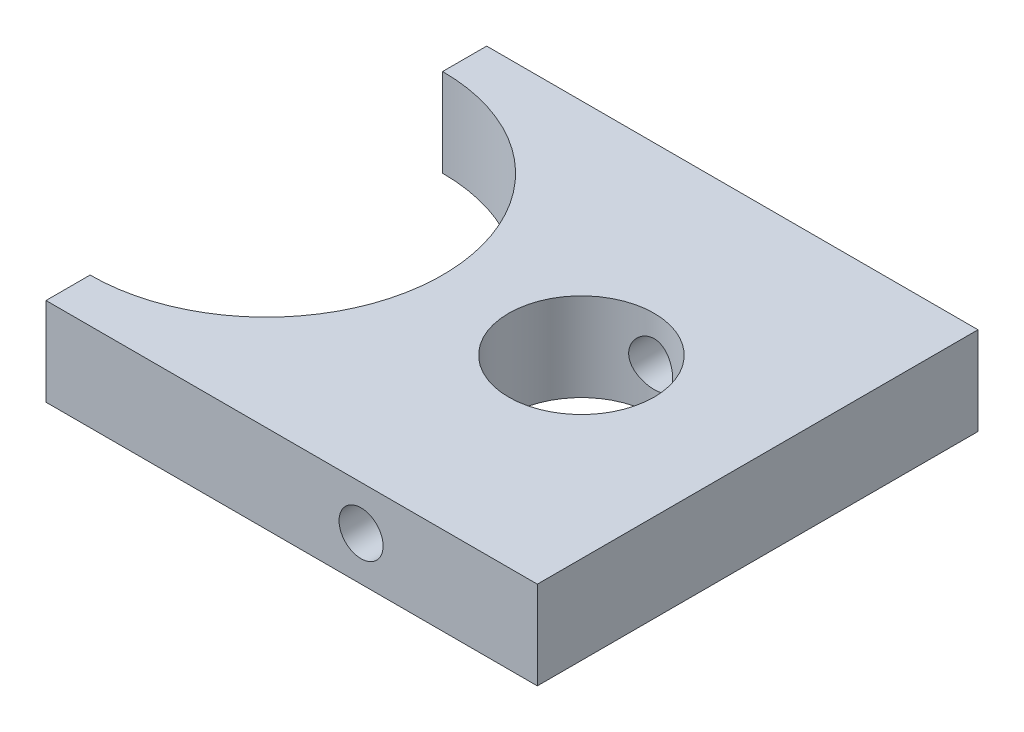
from build123d import *

# Parameters (mm, degrees)
SKETCH1_R           = 20.955
BOSS_EXTRUDE1_DEPTH = 25.4
SKETCH2_R           = 6.35
CUT_EXTRUDE1_DEPTH  = 192.901370566


with BuildPart() as part:
    # Sketch1 → Boss-Extrude1 (new body)
    with BuildSketch(Plane(origin=(0, 0, 0), x_dir=(1, 0, 0), z_dir=(0, 1, 0))):
        with BuildLine():
            Line((0, 0), (141.605, 0))
            Line((141.605, 0), (141.605, 127))
            Line((141.605, 127), (0, 127))
            Line((0, 127), (0, 114.3))
            ThreePointArc((0, 114.3), (50.8, 63.5), (0, 12.7))
            Line((0, 12.7), (0, 0))
        make_face()
        with Locations((90.805, 63.5)):
            Circle(SKETCH1_R, mode=Mode.SUBTRACT)
    extrude(amount=BOSS_EXTRUDE1_DEPTH)

    # Sketch2 → Cut-Extrude1 (cut, through all)
    with BuildSketch(Plane.XY):
        with Locations((90.805, 12.7)):
            Circle(SKETCH2_R)
    extrude(amount=-CUT_EXTRUDE1_DEPTH, mode=Mode.SUBTRACT)


solid = part.part
